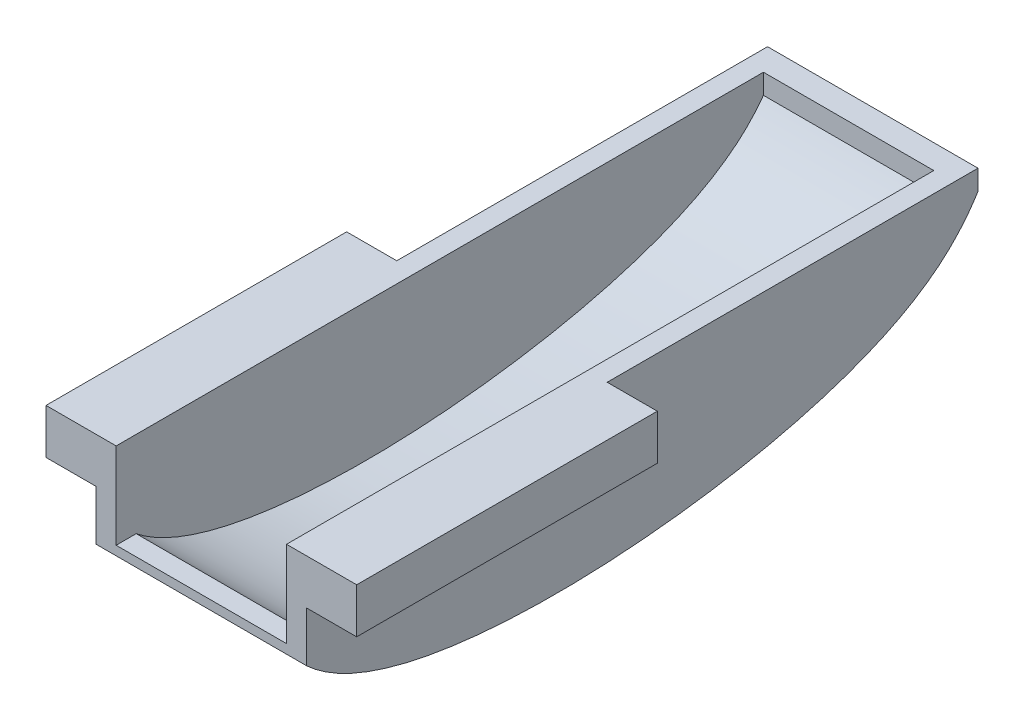
from build123d import *

# Parameters (mm, degrees)
BASEPIEDEAPPOGGIO_START = -10.5
BASEPIEDEAPPOGGIO_DEPTH = 21
LATOSINISTRO_DEPTH      = 2
SCHIZZO3_W              = 5
SCHIZZO3_H              = 4.5
ALETTEAGGANCIO_DEPTH    = 30


# Read off the part's stored shape, not the designer's step: BasePiedeAppoggio
with BuildPart() as part:
    # BasePiedeAppoggio outline → BasePiedeAppoggio (new body)
    with BuildSketch(Plane(origin=(0, 0, 0), x_dir=(0, 0, -1), z_dir=(1, 0, 0)).offset(BASEPIEDEAPPOGGIO_START)):
        with BuildLine():
            Line((-67, -6.58541733), (-67, -7.5))
            add(Edge.make_bspline(
                [(-67, -7.5), (-60, -14), (-44, -17), (-14, -13), (-5, -8), (0, 0)],
                knots=[0, 0, 0, 0, 0, 0, 1, 1, 1, 1, 1, 1], degree=5))
            Line((0, 0), (0, 2))
            Line((0, 2), (-2.409917527, 2))
            Line((-2.409917527, 2), (-2.409917527, 0))
            add(Edge.make_bspline(
                [(-2.409917527, 0), (-2.667324323, -0.353402954), (-3.476108464, -1.377540434), (-5.718312008, -3.574118885), (-10.497685703, -6.435761001), (-19.037438877, -9.233820798), (-29.572047533, -11.136431528), (-38.966676556, -11.799385995), (-46.135832891, -11.693755764), (-51.166703498, -11.28631183), (-55.693282116, -10.549034431), (-58.932001396, -9.671882802), (-61.157085706, -8.829738395), (-62.633910182, -8.137838289), (-63.931461685, -7.382278902), (-64.645771008, -6.869387628), (-65, -6.58541733)],
                knots=[0.030225408, 0.030225408, 0.030225408, 0.030225408, 0.061229523, 0.122459046, 0.244918093, 0.367377139, 0.489836186, 0.612295232, 0.673524756, 0.734754279, 0.795983802, 0.857213325, 0.887828087, 0.918442849, 0.94905761, 0.979672372, 0.979672372, 0.979672372, 0.979672372], degree=3))
            Line((-65, -6.58541733), (-67, -6.58541733))
        make_face()
    extrude(amount=BASEPIEDEAPPOGGIO_DEPTH)

    # Schizzo2 → LatoSinistro (add)
    with BuildSketch(Plane.ZY.offset(10.5)):
        with BuildLine():
            Line((67, -7.5), (67, 2))
            Line((67, 2), (0, 2))
            Line((0, 2), (0, 0))
            add(Edge.make_bspline(
                [(67, -7.5), (60, -14), (44, -17), (14, -13), (5, -8), (0, 0)],
                knots=[0, 0, 0, 0, 0, 0, 1, 1, 1, 1, 1, 1], degree=5))
        make_face()
    latosinistro = extrude(amount=-LATOSINISTRO_DEPTH)

    # LatoDestro: LatoSinistro across plane
    add(latosinistro.mirror(Plane(origin=(0, 0, 0), x_dir=(0, 0, 1), z_dir=(1, 0, 0))))

    # Schizzo3 → AletteAggancio (add)
    with BuildSketch(Plane.XY.offset(67)):
        with Locations((-13, -0.25)):
            Rectangle(SCHIZZO3_W, SCHIZZO3_H)
        with Locations((13, -0.25)):
            Rectangle(SCHIZZO3_W, SCHIZZO3_H)
    extrude(amount=-ALETTEAGGANCIO_DEPTH)


solid = part.part
